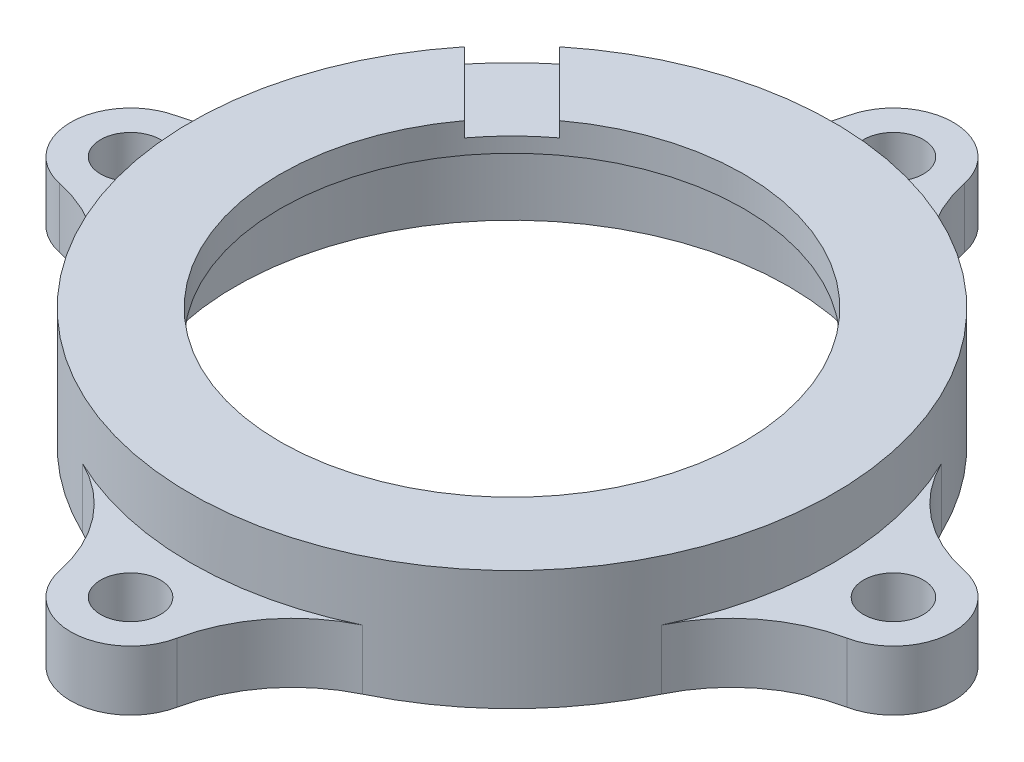
from build123d import *

# Parameters (mm, degrees)
SKETCH1_R           = 21.5
SKETCH1_R_2         = 15.5
BOSS_EXTRUDE1_DEPTH = 4
BOSS_EXTRUDE2_START = 4
SKETCH2_R           = 21.5
SKETCH2_R_2         = 18.5
BOSS_EXTRUDE2_DEPTH = 4
SKETCH3_R           = 18.5
SKETCH3_R_2         = 15
CUT_EXTRUDE1_DEPTH  = 2
SKETCH4_R           = 2
BOSS_EXTRUDE3_DEPTH = 4
FILLET1_R           = 10
CUT_EXTRUDE3_DEPTH  = 1


with BuildPart() as part:
    # Sketch1 → Boss-Extrude1 (new body)
    with BuildSketch(Plane(origin=(0, 0, 0), x_dir=(1, 0, 0), z_dir=(0, 1, 0))):
        with Locations(Location((0, 0, 0), (0, 0, 270))):
            Circle(SKETCH1_R)
        with Locations(Location((0, 0, 0), (0, 0, 270))):
            Circle(SKETCH1_R_2, mode=Mode.SUBTRACT)
    extrude(amount=BOSS_EXTRUDE1_DEPTH)

    # Sketch2 → Boss-Extrude2 (add)
    with BuildSketch(Plane.XZ.offset(BOSS_EXTRUDE2_START)):
        with Locations(Location((0, 0, 0), (0, 0, 270))):
            Circle(SKETCH2_R)
        with Locations(Location((0, 0, 0), (0, 0, 270))):
            Circle(SKETCH2_R_2, mode=Mode.SUBTRACT)
    extrude(amount=-BOSS_EXTRUDE2_DEPTH)

    # Sketch3 → Cut-Extrude1 (cut)
    with BuildSketch(Plane.XZ):
        with Locations(Location((0, 0, 0), (0, 0, 270))):
            Circle(SKETCH3_R)
        Circle(SKETCH3_R_2, mode=Mode.SUBTRACT)
    extrude(amount=-CUT_EXTRUDE1_DEPTH, mode=Mode.SUBTRACT)

    # Sketch4 → Boss-Extrude3 (add)
    # profile 1 of 4: a face of its own
    with BuildSketch(Plane.XZ.offset(4)):
        with BuildLine():
            Line((-25.5, 4), (-20.187008248, 4))
            Line((-20.187008248, 4), (-20.187008248, -4))
            Line((-20.187008248, -4), (-25.5, -4))
            ThreePointArc((-25.5, -4), (-29.5, 0), (-25.5, 4))
        make_face()
        with Locations(Location((-25.5, 0, 0), (0, 0, 270))):
            Circle(SKETCH4_R, mode=Mode.SUBTRACT)
    # profile 2 of 4: a face of its own
    with BuildSketch(Plane.XZ.offset(4)):
        with BuildLine():
            Line((4, 20.187008248), (-4, 20.187008248))
            Line((-4, 20.187008248), (-4, 25.5))
            ThreePointArc((-4, 25.5), (0, 29.5), (4, 25.5))
            Line((4, 25.5), (4, 20.187008248))
        make_face()
        with Locations(Location((0, 25.5, 0), (0, 0, 270))):
            Circle(SKETCH4_R, mode=Mode.SUBTRACT)
    # profile 3 of 4: a face of its own
    with BuildSketch(Plane.XZ.offset(4)):
        with BuildLine():
            Line((20.187008248, -4), (20.187008248, 4))
            Line((20.187008248, 4), (25.5, 4))
            ThreePointArc((25.5, 4), (29.5, 0), (25.5, -4))
            Line((25.5, -4), (20.187008248, -4))
        make_face()
        with Locations(Location((25.5, 0, 0), (0, 0, 270))):
            Circle(SKETCH4_R, mode=Mode.SUBTRACT)
    # profile 4 of 4: a face of its own
    with BuildSketch(Plane.XZ.offset(4)):
        with BuildLine():
            Line((-4, -20.187008248), (4, -20.187008248))
            Line((4, -20.187008248), (4, -25.5))
            ThreePointArc((4, -25.5), (0, -29.5), (-4, -25.5))
            Line((-4, -25.5), (-4, -20.187008248))
        make_face()
        with Locations(Location((0, -25.5, 0), (0, 0, 270))):
            Circle(SKETCH4_R, mode=Mode.SUBTRACT)
    extrude(amount=-BOSS_EXTRUDE3_DEPTH)

    # Fillet1
    # the kernel refuses this fillet: 10 mm, written as the material it adds along each edge
    with BuildSketch(Plane(origin=(-4, 0, 21.124630174), x_dir=(0.016272387136782942, 0, 0.9998675959430181), z_dir=(0, -1, 0)), Plane(origin=(4, 0, -21.124630174), x_dir=(-0.01627238713686073, 0, -0.9998675959430169), z_dir=(0, -1, 0)), Plane(origin=(-21.124630174, 0, -4), x_dir=(-0.9998675959430171, 0, 0.01627238713684981), z_dir=(0, -1, 0)), Plane(origin=(21.124630174, 0, 4), x_dir=(0.9998675959430179, 0, -0.01627238713679413), z_dir=(0, -1, 0))) as fillet1_piece_1:
        with BuildLine():
            CenterArc((7.07924631, 9.82068168), FILLET1_R, 206.72107826, 52.41213662)
            Line((-1.852813991, 5.324205419), (-2.746020021, 4.874557792))
            ThreePointArc((-2.746020021, 4.874557792), (-1.695593605, 2.394427141), (-0.979383425, -0.202010165))
            Line((-0.979383425, -0.202010165), (0.016272387, -0.999867596))
            ThreePointArc((0.016272387, -0.999867596), (4.391062896, -0.928669884), (5.00545854, -0.982068168))
            Line((5.00545854, -0.982068168), (5.193984701, 0))
        make_face()
    extrude(amount=4)
    with BuildSketch(Plane(origin=(-21.124630174, 0, 4), x_dir=(-0.9998675959430171, 0, -0.016272387136849455), z_dir=(0, -1, 0)), Plane(origin=(-4, 0, -21.124630174), x_dir=(0.0162723871369052, 0, -0.9998675959430161), z_dir=(0, -1, 0)), Plane(origin=(21.124630174, 0, -4), x_dir=(0.9998675959430168, 0, 0.016272387136866445), z_dir=(0, -1, 0)), Plane(origin=(4, 0, 21.124630174), x_dir=(-0.0162723871368113, 0, 0.9998675959430178), z_dir=(0, -1, 0))) as fillet1_piece_2:
        with BuildLine():
            CenterArc((7.07924631, -9.82068168), FILLET1_R, 100.86678512, 52.41213662)
            Line((-1.852813991, -5.324205419), (-2.746020021, -4.874557792))
            ThreePointArc((-2.746020021, -4.874557792), (-1.695593605, -2.394427141), (-0.979383425, 0.202010165))
            Line((-0.979383425, 0.202010165), (0.016272387, 0.999867596))
            ThreePointArc((0.016272387, 0.999867596), (4.391062896, 0.928669884), (5.00545854, 0.982068168))
            Line((5.00545854, 0.982068168), (5.193984701, 0))
        make_face()
    extrude(amount=4)

    # Sketch6 → Cut-Extrude3 (cut)
    with BuildSketch(Plane(origin=(0, 4, 0), x_dir=(1, 0, 0), z_dir=(0, 1, 0))):
        Polygon((-8.667268163, 11.849248678), (-15.190647858, 18.372628373), (-18.372628373, 15.190647858), (-11.849248678, 8.667268163), align=None)
    extrude(amount=-CUT_EXTRUDE3_DEPTH, mode=Mode.SUBTRACT)


solid = part.part
